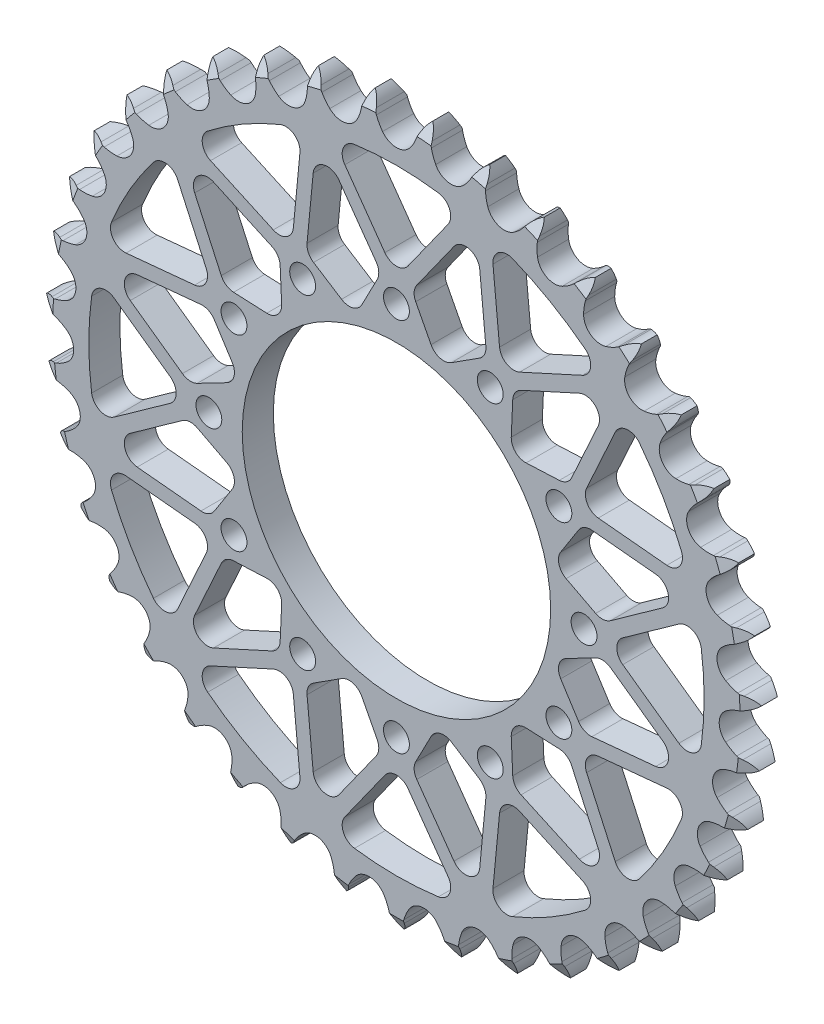
from build123d import *

# Parameters (mm, degrees)
EXTRUSION_DEPTH          = 7.2136
CUT_EXTRUDE_DEPTH        = 118.514389318
CUT_EXTRUDE_DEPTH_BACK   = 118.514389318
SKETCH1_R                = 35.764294032
F_6_0MM_DOWEL_HOLE1_D    = 6
CIRPATTERN1_COUNT        = 12
CUT_EXTRUDE2_DEPTH       = 118.514389318
FILLET2_R                = 3.302
CIRPATTERN3_COUNT        = 12
FILLET2_OF_CIRPATTERN3_R = 3.302


with BuildPart() as part:
    # Teeth Sketch → Extrusion (new body)
    with BuildSketch(Plane.XY):
        with BuildLine():
            ThreePointArc((6.676484762, 82.703103732), (5.710873677, 81.555589606), (5.037571935, 80.215493266))
            Line((5.037571935, 80.215493266), (4.65053543, 79.150636707))
            ThreePointArc((4.65053543, 79.150636707), (4.030589042, 77.787636082), (3.22092759, 76.5280518))
            ThreePointArc((3.22092759, 76.5280518), (0, 74.905926143), (-3.22092759, 76.5280518))
            ThreePointArc((-3.22092759, 76.5280518), (-4.030589042, 77.787636082), (-4.65053543, 79.150636707))
            Line((-4.65053543, 79.150636707), (-5.037571935, 80.215493266))
            ThreePointArc((-5.037571935, 80.215493266), (-5.710873677, 81.555589606), (-6.676484762, 82.703103732))
            ThreePointArc((-6.676484762, 82.703103732), (-7.445517227, 81.415554702), (-7.895133318, 79.984807062))
            Line((-7.895133318, 79.984807062), (-8.106342797, 78.871655094))
            ThreePointArc((-8.106342797, 78.871655094), (-8.499620367, 77.426858575), (-9.096745387, 76.053706749))
            ThreePointArc((-9.096745387, 76.053706749), (-12.015755556, 73.935914073), (-15.455180235, 75.020360508))
            ThreePointArc((-15.455180235, 75.020360508), (-16.456408311, 76.133754674), (-17.286967233, 77.379658404))
            Line((-17.286967233, 77.379658404), (-17.83980672, 78.368640329))
            ThreePointArc((-17.83980672, 78.368640329), (-18.719355953, 79.583377579), (-19.856536839, 80.561136787))
            ThreePointArc((-19.856536839, 80.561136787), (-20.409073146, 79.166899696), (-20.623358765, 77.682556369))
            Line((-20.623358765, 77.682556369), (-20.653271004, 76.549939044))
            ThreePointArc((-20.653271004, 76.549939044), (-20.809694072, 75.060766102), (-21.178817437, 73.609610642))
            ThreePointArc((-21.178817437, 73.609610642), (-23.720309356, 71.051000665), (-27.289151829, 71.569681286))
            ThreePointArc((-27.289151829, 71.569681286), (-28.456015249, 72.508049011), (-29.475675664, 73.604587595))
            Line((-29.475675664, 73.604587595), (-30.179999883, 74.492080773))
            ThreePointArc((-30.179999883, 74.492080773), (-31.243016742, 75.549997876), (-32.522315041, 76.332678717))
            ThreePointArc((-32.522315041, 76.332678717), (-32.844044791, 74.867863573), (-32.817450053, 73.368368272))
            Line((-32.817450053, 73.368368272), (-32.66529034, 72.245619783))
            ThreePointArc((-32.66529034, 72.245619783), (-32.580807632, 70.750639215), (-32.71236924, 69.259064285))
            ThreePointArc((-32.71236924, 69.259064285), (-34.810519602, 66.325903661), (-38.416348726, 66.265384911))
            ThreePointArc((-38.416348726, 66.265384911), (-39.71862634, 67.004422965), (-40.900979579, 67.923196629))
            Line((-40.900979579, 67.923196629), (-41.738546902, 68.686215454))
            ThreePointArc((-41.738546902, 68.686215454), (-42.957499809, 69.559912912), (-44.345782367, 70.127244363))
            ThreePointArc((-44.345782367, 70.127244363), (-44.428372928, 68.629789109), (-44.161586623, 67.153977974))
            Line((-44.161586623, 67.153977974), (-43.831295815, 66.070176918))
            ThreePointArc((-43.831295815, 66.070176918), (-43.508095388, 64.608107935), (-43.398687863, 63.114744543))
            ThreePointArc((-43.398687863, 63.114744543), (-44.999155676, 59.883000591), (-48.54858237, 59.244849876))
            ThreePointArc((-48.54858237, 59.244849876), (-49.952545871, 59.765417561), (-51.266969607, 60.48263055))
            Line((-51.266969607, 60.48263055), (-52.21608748, 61.101413234))
            ThreePointArc((-52.21608748, 61.101413234), (-53.559406195, 61.768262742), (-55.020717224, 62.105551216))
            ThreePointArc((-55.020717224, 62.105551216), (-54.862029543, 60.614239157), (-54.361961296, 59.200334922))
            Line((-54.361961296, 59.200334922), (-53.862093752, 58.183551176))
            ThreePointArc((-53.862093752, 58.183551176), (-53.308546327, 56.792260597), (-52.961003266, 55.335786069))
            ThreePointArc((-52.961003266, 55.335786069), (-54.022337255, 51.889159262), (-57.423433231, 50.689904348))
            ThreePointArc((-57.423433231, 50.689904348), (-58.892720703, 50.978519235), (-60.305172051, 51.475596109))
            Line((-60.305172051, 51.475596109), (-61.34125882, 51.934116506))
            ThreePointArc((-61.34125882, 51.934116506), (-62.774152094, 52.376847013), (-64.270644405, 52.475356916))
            ThreePointArc((-64.270644405, 52.475356916), (-63.87478841, 51.02881225), (-63.154389727, 49.713434291))
            Line((-63.154389727, 49.713434291), (-62.497891753, 48.790002021))
            ThreePointArc((-62.497891753, 48.790002021), (-61.728333918, 47.505523541), (-61.151656504, 46.123659804))
            ThreePointArc((-61.151656504, 46.123659804), (-61.646368676, 42.551415963), (-64.811047336, 40.822116924))
            ThreePointArc((-64.811047336, 40.822116924), (-66.307605004, 40.871304038), (-67.781502216, 41.135370767))
            Line((-67.781502216, 41.135370767), (-68.877723777, 41.42175344))
            ThreePointArc((-68.877723777, 41.42175344), (-70.363080428, 41.628898458), (-71.855995657, 41.486078435))
            ThreePointArc((-71.855995657, 41.486078435), (-71.23322381, 40.12176591), (-70.311152637, 38.938981826))
            Line((-70.311152637, 38.938981826), (-69.515027187, 38.132817442))
            ThreePointArc((-69.515027187, 38.132817442), (-68.549390085, 36.988418379), (-67.75851396, 35.716954977))
            ThreePointArc((-67.75851396, 35.716954977), (-67.673791529, 32.111613343), (-70.520089358, 29.897058114))
            ThreePointArc((-70.520089358, 29.897058114), (-72.005157166, 29.705543536), (-73.502327078, 29.729760931))
            Line((-73.502327078, 29.729760931), (-74.630291869, 29.836588719))
            ThreePointArc((-74.630291869, 29.836588719), (-76.129641939, 29.8027833), (-77.580314364, 29.422332315))
            ThreePointArc((-77.580314364, 29.422332315), (-76.74675613, 28.175586908), (-75.646893627, 27.156030185))
            Line((-75.646893627, 27.156030185), (-74.731759931, 26.488012922))
            ThreePointArc((-74.731759931, 26.488012922), (-73.595053056, 25.51333261), (-72.610461496, 24.385199777))
            ThreePointArc((-72.610461496, 24.385199777), (-71.948498729, 20.840136804), (-74.402698108, 18.197681204))
            ThreePointArc((-74.402698108, 18.197681204), (-75.837813579, 17.77042506), (-77.319480277, 17.554165902))
            Line((-77.319480277, 17.554165902), (-78.449974603, 17.478672021))
            ThreePointArc((-78.449974603, 17.478672021), (-79.924485713, 17.204791709), (-81.295343681, 16.596563242))
            ThreePointArc((-81.295343681, 16.596563242), (-80.27258778, 15.499675005), (-79.023419807, 14.669751627))
            Line((-79.023419807, 14.669751627), (-78.012979347, 14.15718278))
            ThreePointArc((-78.012979347, 14.15718278), (-76.734642811, 13.377464928), (-75.58183622, 12.421880712))
            ThreePointArc((-75.58183622, 12.421880712), (-74.359777605, 9.028911669), (-76.358316059, 6.026993909))
            ThreePointArc((-76.358316059, 6.026993909), (-77.706310456, 5.375061909), (-79.134099551, 4.923927198))
            Line((-79.134099551, 4.923927198), (-80.237844202, 4.6680669))
            ThreePointArc((-80.237844202, 4.6680669), (-81.649327289, 4.161205049), (-82.904866299, 3.340951899))
            ThreePointArc((-82.904866299, 3.340951899), (-81.719401571, 2.422329661), (-80.353280924, 1.803534207))
            Line((-80.353280924, 1.803534207), (-79.273703577, 1.45968904))
            ThreePointArc((-79.273703577, 1.45968904), (-77.886845624, 0.895127931), (-76.595681088, 0.136841462))
            ThreePointArc((-76.595681088, 0.136841462), (-74.8451773, -3.016157536), (-76.336293733, -6.299789363))
            ThreePointArc((-76.336293733, -6.299789363), (-77.56225471, -7.159512522), (-78.899187214, -7.833838635))
            Line((-78.899187214, -7.833838635), (-79.947595784, -8.263438702))
            ThreePointArc((-79.947595784, -8.263438702), (-81.259494176, -8.990154635), (-82.367196428, -10.001188343))
            ThreePointArc((-82.367196428, -10.001188343), (-81.049725787, -10.717752749), (-79.602034272, -11.109393802))
            Line((-79.602034272, -11.109393802), (-78.481280524, -11.275609878))
            ThreePointArc((-78.481280524, -11.275609878), (-77.021820047, -11.610392409), (-75.625738049, -12.151741911))
            ThreePointArc((-75.625738049, -12.151741911), (-73.392126218, -14.983109845), (-74.337201497, -18.463411399))
            ThreePointArc((-74.337201497, -18.463411399), (-75.409377308, -19.50865934), (-76.620827372, -20.388712162))
            Line((-76.620827372, -20.388712162), (-77.586746629, -20.980925582))
            ThreePointArc((-77.586746629, -20.980925582), (-78.765082849, -21.908674036), (-79.696259435, -23.08430306))
            ThreePointArc((-79.696259435, -23.08430306), (-78.280904679, -23.580250992), (-76.789136745, -23.734594346))
            Line((-76.789136745, -23.734594346), (-75.656233531, -23.718876424))
            ThreePointArc((-75.656233531, -23.718876424), (-74.161969788, -23.815209685), (-72.697128119, -24.125601551))
            ThreePointArc((-72.697128119, -24.125601551), (-70.038257617, -26.562007479), (-70.41281479, -30.148840778))
            ThreePointArc((-70.41281479, -30.148840778), (-71.303436645, -31.352542128), (-72.358028349, -32.415528753))
            Line((-72.358028349, -32.415528753), (-73.216441492, -33.155017511))
            ThreePointArc((-73.216441492, -33.155017511), (-74.230697248, -34.259770288), (-74.961231185, -35.569546454))
            ThreePointArc((-74.961231185, -35.569546454), (-73.484649258, -35.832033121), (-71.987440912, -35.745081364))
            Line((-71.987440912, -35.745081364), (-70.871729829, -35.547836529))
            ThreePointArc((-70.871729829, -35.547836529), (-69.381363468, -35.403225539), (-67.885700756, -35.474620783))
            ThreePointArc((-67.885700756, -35.474620783), (-64.870434934, -37.452963072), (-64.664773166, -41.053431017))
            ThreePointArc((-64.664773166, -41.053431017), (-65.350774426, -42.384410543), (-66.221194398, -43.602800177))
            Line((-66.221194398, -43.602800177), (-66.949868978, -44.470411902))
            ThreePointArc((-66.949868978, -44.470411902), (-67.773775581, -45.723556485), (-68.284746423, -47.133557278))
            ThreePointArc((-68.284746423, -47.133557278), (-66.785180021, -47.155784414), (-65.321308173, -46.829789551))
            Line((-65.321308173, -46.829789551), (-64.251685552, -46.456126341))
            ThreePointArc((-64.251685552, -46.456126341), (-62.803816278, -46.074316448), (-61.316069403, -45.904865971))
            ThreePointArc((-61.316069403, -45.904865971), (-58.022502061, -47.373906594), (-57.241947884, -50.894758957))
            ThreePointArc((-57.241947884, -50.894758957), (-57.705561477, -52.318544989), (-58.369266298, -53.66078198))
            Line((-58.369266298, -53.66078198), (-58.949330025, -54.634045983))
            ThreePointArc((-58.949330025, -54.634045983), (-59.561548726, -56.003126587), (-59.839722596, -57.476833727))
            ThreePointArc((-59.839722596, -57.476833727), (-58.356009703, -57.25822566), (-56.963387864, -56.701630787))
            Line((-56.963387864, -56.701630787), (-55.967556369, -56.161226883))
            ThreePointArc((-55.967556369, -56.161226883), (-54.599683236, -55.552106762), (-53.15838406, -55.146199243))
            ThreePointArc((-53.15838406, -55.146199243), (-49.671816862, -56.06789082), (-48.336586219, -59.417939375))
            ThreePointArc((-48.336586219, -59.417939375), (-48.565804798, -60.897656602), (-49.00560486, -62.328977716))
            Line((-49.00560486, -62.328977716), (-49.422034389, -63.382686971))
            ThreePointArc((-49.422034389, -63.382686971), (-49.806709045, -64.832245127), (-49.844881387, -66.331490374))
            ThreePointArc((-49.844881387, -66.331490374), (-48.415449386, -65.877708938), (-47.130145731, -65.104929569))
            Line((-47.130145731, -65.104929569), (-46.233896874, -64.411781148))
            ThreePointArc((-46.233896874, -64.411781148), (-44.981447078, -63.591126692), (-43.623924493, -62.959274922))
            ThreePointArc((-43.623924493, -62.959274922), (-40.034657698, -63.309746125), (-38.179332362, -66.402226373))
            ThreePointArc((-38.179332362, -66.402226373), (-38.168219284, -67.899550896), (-38.372723998, -69.38288567))
            Line((-38.372723998, -69.38288567), (-38.614734022, -70.489749661))
            ThreePointArc((-38.614734022, -70.489749661), (-38.761901763, -71.982242573), (-38.559083932, -73.468196262))
            ThreePointArc((-38.559083932, -73.468196262), (-37.220954361, -72.790994159), (-36.076257579, -71.822044874))
            Line((-36.076257579, -71.822044874), (-35.302803736, -70.994104116))
            ThreePointArc((-35.302803736, -70.994104116), (-34.198215068, -69.983169844), (-32.959628196, -69.141738451))
            ThreePointArc((-32.959628196, -69.141738451), (-29.360621929, -68.91191226), (-27.033253851, -71.666730588))
            ThreePointArc((-27.033253851, -71.666730588), (-26.78209694, -73.142882488), (-26.74600974, -74.639813329))
            Line((-26.74600974, -74.639813329), (-26.807332328, -75.77116486))
            ThreePointArc((-26.807332328, -75.77116486), (-26.713181585, -77.267937748), (-26.274626458, -78.702114459))
            ThreePointArc((-26.274626458, -78.702114459), (-25.06245617, -77.819030866), (-24.088013307, -76.679006943))
            Line((-24.088013307, -76.679006943), (-23.457386525, -75.737717079))
            ThreePointArc((-23.457386525, -75.737717079), (-22.529267252, -74.562685657), (-21.441694841, -73.533467273))
            ThreePointArc((-21.441694841, -73.533467273), (-17.926161474, -72.729296065), (-15.187028265, -75.075104125))
            ThreePointArc((-15.187028265, -75.075104125), (-14.702332353, -76.491851845), (-14.426587879, -77.96360903))
            Line((-14.426587879, -77.96360903), (-14.305634807, -79.090146691))
            ThreePointArc((-14.305634807, -79.090146691), (-13.972604036, -80.552433921), (-13.309669959, -81.897689231))
            ThreePointArc((-13.309669959, -81.897689231), (-12.254853529, -80.83159555), (-11.475902142, -79.55002301))
            Line((-11.475902142, -79.55002301), (-11.004435324, -78.519762952))
            ThreePointArc((-11.004435324, -78.519762952), (-10.276823247, -77.211067077), (-9.368432854, -76.020717918))
            ThreePointArc((-9.368432854, -76.020717918), (-6.027422853, -74.663029306), (-2.947466624, -76.5390719))
            ThreePointArc((-2.947466624, -76.5390719), (-2.241785081, -77.859722417), (-1.733524971, -79.26818821))
            Line((-1.733524971, -79.26818821), (-1.43342886, -80.360735266))
            ThreePointArc((-1.43342886, -80.360735266), (-0.870143382, -81.750664368), (0, -82.97215687))
            ThreePointArc((0, -82.97215687), (0.870143382, -81.750664368), (1.43342886, -80.360735266))
            Line((1.43342886, -80.360735266), (1.733524971, -79.26818821))
            ThreePointArc((1.733524971, -79.26818821), (2.241785081, -77.859722417), (2.947466624, -76.5390719))
            ThreePointArc((2.947466624, -76.5390719), (6.027422853, -74.663029306), (9.368432854, -76.020717918))
            ThreePointArc((9.368432854, -76.020717918), (10.276823247, -77.211067077), (11.004435324, -78.519762952))
            Line((11.004435324, -78.519762952), (11.475902142, -79.55002301))
            ThreePointArc((11.475902142, -79.55002301), (12.254853529, -80.83159555), (13.309669959, -81.897689231))
            ThreePointArc((13.309669959, -81.897689231), (13.972604036, -80.552433921), (14.305634807, -79.090146691))
            Line((14.305634807, -79.090146691), (14.426587879, -77.96360903))
            ThreePointArc((14.426587879, -77.96360903), (14.702332353, -76.491851845), (15.187028265, -75.075104125))
            ThreePointArc((15.187028265, -75.075104125), (17.926161474, -72.729296065), (21.441694841, -73.533467273))
            ThreePointArc((21.441694841, -73.533467273), (22.529267252, -74.562685657), (23.457386525, -75.737717079))
            Line((23.457386525, -75.737717079), (24.088013307, -76.679006943))
            ThreePointArc((24.088013307, -76.679006943), (25.06245617, -77.819030866), (26.274626458, -78.702114459))
            ThreePointArc((26.274626458, -78.702114459), (26.713181585, -77.267937748), (26.807332328, -75.77116486))
            Line((26.807332328, -75.77116486), (26.74600974, -74.639813329))
            ThreePointArc((26.74600974, -74.639813329), (26.78209694, -73.142882488), (27.033253851, -71.666730588))
            ThreePointArc((27.033253851, -71.666730588), (29.360621929, -68.91191226), (32.959628196, -69.141738451))
            ThreePointArc((32.959628196, -69.141738451), (34.198215068, -69.983169844), (35.302803736, -70.994104116))
            Line((35.302803736, -70.994104116), (36.076257579, -71.822044874))
            ThreePointArc((36.076257579, -71.822044874), (37.220954361, -72.790994159), (38.559083932, -73.468196262))
            ThreePointArc((38.559083932, -73.468196262), (38.761901763, -71.982242573), (38.614734022, -70.489749661))
            Line((38.614734022, -70.489749661), (38.372723998, -69.38288567))
            ThreePointArc((38.372723998, -69.38288567), (38.168219284, -67.899550896), (38.179332362, -66.402226373))
            ThreePointArc((38.179332362, -66.402226373), (40.034657698, -63.309746125), (43.623924493, -62.959274922))
            ThreePointArc((43.623924493, -62.959274922), (44.981447078, -63.591126692), (46.233896874, -64.411781148))
            Line((46.233896874, -64.411781148), (47.130145731, -65.104929569))
            ThreePointArc((47.130145731, -65.104929569), (48.415449386, -65.877708938), (49.844881387, -66.331490374))
            ThreePointArc((49.844881387, -66.331490374), (49.806709045, -64.832245127), (49.422034389, -63.382686971))
            Line((49.422034389, -63.382686971), (49.00560486, -62.328977716))
            ThreePointArc((49.00560486, -62.328977716), (48.565804798, -60.897656602), (48.336586219, -59.417939375))
            ThreePointArc((48.336586219, -59.417939375), (49.671816862, -56.06789082), (53.15838406, -55.146199243))
            ThreePointArc((53.15838406, -55.146199243), (54.599683236, -55.552106762), (55.967556369, -56.161226883))
            Line((55.967556369, -56.161226883), (56.963387864, -56.701630787))
            ThreePointArc((56.963387864, -56.701630787), (58.356009703, -57.25822566), (59.839722596, -57.476833727))
            ThreePointArc((59.839722596, -57.476833727), (59.561548726, -56.003126587), (58.949330025, -54.634045983))
            Line((58.949330025, -54.634045983), (58.369266298, -53.66078198))
            ThreePointArc((58.369266298, -53.66078198), (57.705561477, -52.318544989), (57.241947884, -50.894758957))
            ThreePointArc((57.241947884, -50.894758957), (58.022502061, -47.373906594), (61.316069403, -45.904865971))
            ThreePointArc((61.316069403, -45.904865971), (62.803816278, -46.074316448), (64.251685552, -46.456126341))
            Line((64.251685552, -46.456126341), (65.321308173, -46.829789551))
            ThreePointArc((65.321308173, -46.829789551), (66.785180021, -47.155784414), (68.284746423, -47.133557278))
            ThreePointArc((68.284746423, -47.133557278), (67.773775581, -45.723556485), (66.949868978, -44.470411902))
            Line((66.949868978, -44.470411902), (66.221194398, -43.602800177))
            ThreePointArc((66.221194398, -43.602800177), (65.350774426, -42.384410543), (64.664773166, -41.053431017))
            ThreePointArc((64.664773166, -41.053431017), (64.870434934, -37.452963072), (67.885700756, -35.474620783))
            ThreePointArc((67.885700756, -35.474620783), (69.381363468, -35.403225539), (70.871729829, -35.547836529))
            Line((70.871729829, -35.547836529), (71.987440912, -35.745081364))
            ThreePointArc((71.987440912, -35.745081364), (73.484649258, -35.832033121), (74.961231185, -35.569546454))
            ThreePointArc((74.961231185, -35.569546454), (74.230697248, -34.259770288), (73.216441492, -33.155017511))
            Line((73.216441492, -33.155017511), (72.358028349, -32.415528753))
            ThreePointArc((72.358028349, -32.415528753), (71.303436645, -31.352542128), (70.41281479, -30.148840778))
            ThreePointArc((70.41281479, -30.148840778), (70.038257617, -26.562007479), (72.697128119, -24.125601551))
            ThreePointArc((72.697128119, -24.125601551), (74.161969788, -23.815209685), (75.656233531, -23.718876424))
            Line((75.656233531, -23.718876424), (76.789136745, -23.734594346))
            ThreePointArc((76.789136745, -23.734594346), (78.280904679, -23.580250992), (79.696259435, -23.08430306))
            ThreePointArc((79.696259435, -23.08430306), (78.765082849, -21.908674036), (77.586746629, -20.980925582))
            Line((77.586746629, -20.980925582), (76.620827372, -20.388712162))
            ThreePointArc((76.620827372, -20.388712162), (75.409377308, -19.50865934), (74.337201497, -18.463411399))
            ThreePointArc((74.337201497, -18.463411399), (73.392126218, -14.983109845), (75.625738049, -12.151741911))
            ThreePointArc((75.625738049, -12.151741911), (77.021820047, -11.610392409), (78.481280524, -11.275609878))
            Line((78.481280524, -11.275609878), (79.602034272, -11.109393802))
            ThreePointArc((79.602034272, -11.109393802), (81.049725787, -10.717752749), (82.367196428, -10.001188343))
            ThreePointArc((82.367196428, -10.001188343), (81.259494176, -8.990154635), (79.947595784, -8.263438702))
            Line((79.947595784, -8.263438702), (78.899187214, -7.833838635))
            ThreePointArc((78.899187214, -7.833838635), (77.56225471, -7.159512522), (76.336293733, -6.299789363))
            ThreePointArc((76.336293733, -6.299789363), (74.8451773, -3.016157536), (76.595681088, 0.136841462))
            ThreePointArc((76.595681088, 0.136841462), (77.886845624, 0.895127931), (79.273703577, 1.45968904))
            Line((79.273703577, 1.45968904), (80.353280924, 1.803534207))
            ThreePointArc((80.353280924, 1.803534207), (81.719401571, 2.422329661), (82.904866299, 3.340951899))
            ThreePointArc((82.904866299, 3.340951899), (81.649327289, 4.161205049), (80.237844202, 4.6680669))
            Line((80.237844202, 4.6680669), (79.134099551, 4.923927198))
            ThreePointArc((79.134099551, 4.923927198), (77.706310456, 5.375061909), (76.358316059, 6.026993909))
            ThreePointArc((76.358316059, 6.026993909), (74.359777605, 9.028911669), (75.58183622, 12.421880712))
            ThreePointArc((75.58183622, 12.421880712), (76.734642811, 13.377464928), (78.012979347, 14.15718278))
            Line((78.012979347, 14.15718278), (79.023419807, 14.669751627))
            ThreePointArc((79.023419807, 14.669751627), (80.27258778, 15.499675005), (81.295343681, 16.596563242))
            ThreePointArc((81.295343681, 16.596563242), (79.924485713, 17.204791709), (78.449974603, 17.478672021))
            Line((78.449974603, 17.478672021), (77.319480277, 17.554165902))
            ThreePointArc((77.319480277, 17.554165902), (75.837813579, 17.77042506), (74.402698108, 18.197681204))
            ThreePointArc((74.402698108, 18.197681204), (71.948498729, 20.840136804), (72.610461496, 24.385199777))
            ThreePointArc((72.610461496, 24.385199777), (73.595053056, 25.51333261), (74.731759931, 26.488012922))
            Line((74.731759931, 26.488012922), (75.646893627, 27.156030185))
            ThreePointArc((75.646893627, 27.156030185), (76.74675613, 28.175586908), (77.580314364, 29.422332315))
            ThreePointArc((77.580314364, 29.422332315), (76.129641939, 29.8027833), (74.630291869, 29.836588719))
            Line((74.630291869, 29.836588719), (73.502327078, 29.729760931))
            ThreePointArc((73.502327078, 29.729760931), (72.005157166, 29.705543536), (70.520089358, 29.897058114))
            ThreePointArc((70.520089358, 29.897058114), (67.673791529, 32.111613343), (67.75851396, 35.716954977))
            ThreePointArc((67.75851396, 35.716954977), (68.549390085, 36.988418379), (69.515027187, 38.132817442))
            Line((69.515027187, 38.132817442), (70.311152637, 38.938981826))
            ThreePointArc((70.311152637, 38.938981826), (71.23322381, 40.12176591), (71.855995657, 41.486078435))
            ThreePointArc((71.855995657, 41.486078435), (70.363080428, 41.628898458), (68.877723777, 41.42175344))
            Line((68.877723777, 41.42175344), (67.781502216, 41.135370767))
            ThreePointArc((67.781502216, 41.135370767), (66.307605004, 40.871304038), (64.811047336, 40.822116924))
            ThreePointArc((64.811047336, 40.822116924), (61.646368676, 42.551415963), (61.151656504, 46.123659804))
            ThreePointArc((61.151656504, 46.123659804), (61.728333918, 47.505523541), (62.497891753, 48.790002021))
            Line((62.497891753, 48.790002021), (63.154389727, 49.713434291))
            ThreePointArc((63.154389727, 49.713434291), (63.87478841, 51.02881225), (64.270644405, 52.475356916))
            ThreePointArc((64.270644405, 52.475356916), (62.774152094, 52.376847013), (61.34125882, 51.934116506))
            Line((61.34125882, 51.934116506), (60.305172051, 51.475596109))
            ThreePointArc((60.305172051, 51.475596109), (58.892720703, 50.978519235), (57.423433231, 50.689904348))
            ThreePointArc((57.423433231, 50.689904348), (54.022337255, 51.889159262), (52.961003266, 55.335786069))
            ThreePointArc((52.961003266, 55.335786069), (53.308546327, 56.792260597), (53.862093752, 58.183551176))
            Line((53.862093752, 58.183551176), (54.361961296, 59.200334922))
            ThreePointArc((54.361961296, 59.200334922), (54.862029543, 60.614239157), (55.020717224, 62.105551216))
            ThreePointArc((55.020717224, 62.105551216), (53.559406195, 61.768262742), (52.21608748, 61.101413234))
            Line((52.21608748, 61.101413234), (51.266969607, 60.48263055))
            ThreePointArc((51.266969607, 60.48263055), (49.952545871, 59.765417561), (48.54858237, 59.244849876))
            ThreePointArc((48.54858237, 59.244849876), (44.999155676, 59.883000591), (43.398687863, 63.114744543))
            ThreePointArc((43.398687863, 63.114744543), (43.508095388, 64.608107935), (43.831295815, 66.070176918))
            Line((43.831295815, 66.070176918), (44.161586623, 67.153977974))
            ThreePointArc((44.161586623, 67.153977974), (44.428372928, 68.629789109), (44.345782367, 70.127244363))
            ThreePointArc((44.345782367, 70.127244363), (42.957499809, 69.559912912), (41.738546902, 68.686215454))
            Line((41.738546902, 68.686215454), (40.900979579, 67.923196629))
            ThreePointArc((40.900979579, 67.923196629), (39.71862634, 67.004422965), (38.416348726, 66.265384911))
            ThreePointArc((38.416348726, 66.265384911), (34.810519602, 66.325903661), (32.71236924, 69.259064285))
            ThreePointArc((32.71236924, 69.259064285), (32.580807632, 70.750639215), (32.66529034, 72.245619783))
            Line((32.66529034, 72.245619783), (32.817450053, 73.368368272))
            ThreePointArc((32.817450053, 73.368368272), (32.844044791, 74.867863573), (32.522315041, 76.332678717))
            ThreePointArc((32.522315041, 76.332678717), (31.243016742, 75.549997876), (30.179999883, 74.492080773))
            Line((30.179999883, 74.492080773), (29.475675664, 73.604587595))
            ThreePointArc((29.475675664, 73.604587595), (28.456015249, 72.508049011), (27.289151829, 71.569681286))
            ThreePointArc((27.289151829, 71.569681286), (23.720309356, 71.051000665), (21.178817437, 73.609610642))
            ThreePointArc((21.178817437, 73.609610642), (20.809694072, 75.060766102), (20.653271004, 76.549939044))
            Line((20.653271004, 76.549939044), (20.623358765, 77.682556369))
            ThreePointArc((20.623358765, 77.682556369), (20.409073146, 79.166899696), (19.856536839, 80.561136787))
            ThreePointArc((19.856536839, 80.561136787), (18.719355953, 79.583377579), (17.83980672, 78.368640329))
            Line((17.83980672, 78.368640329), (17.286967233, 77.379658404))
            ThreePointArc((17.286967233, 77.379658404), (16.456408311, 76.133754674), (15.455180235, 75.020360508))
            ThreePointArc((15.455180235, 75.020360508), (12.015755556, 73.935914073), (9.096745387, 76.053706749))
            ThreePointArc((9.096745387, 76.053706749), (8.499620367, 77.426858575), (8.106342797, 78.871655094))
            Line((8.106342797, 78.871655094), (7.895133318, 79.984807062))
            ThreePointArc((7.895133318, 79.984807062), (7.445517227, 81.415554702), (6.676484762, 82.703103732))
        make_face()
    extrude(amount=EXTRUSION_DEPTH)

    # Sketch1 → Cut-Extrude (cut, two sides: drawn at the far end of the back side and taken through both)
    with BuildSketch(Plane(origin=(0, 0, 0), x_dir=(-1, 0, 0), z_dir=(0, 0, -1)).offset(-CUT_EXTRUDE_DEPTH_BACK)):
        Circle(SKETCH1_R)
    extrude(amount=CUT_EXTRUDE_DEPTH + CUT_EXTRUDE_DEPTH_BACK, mode=Mode.SUBTRACT)

    # Ø6.0mm Dowel Hole1 (through all)
    with Locations(Plane.XY.offset(7.2136)):
        with Locations((-43.500000122, 0)):
            f_6_0mm_dowel_hole1 = Hole(F_6_0MM_DOWEL_HOLE1_D / 2)

    # CirPattern1: Ø6.0mm Dowel Hole1 ×12 about axis
    cirpattern1_axis = Axis((0, 0, 0), (0, 0, 1))
    for i in range(1, CIRPATTERN1_COUNT):
        add(f_6_0mm_dowel_hole1.rotate(cirpattern1_axis, i * 360 / CIRPATTERN1_COUNT), mode=Mode.SUBTRACT)

    # Sketch9 → Cut-Extrude2 (cut, through all)
    with BuildSketch(Plane.XY):
        with BuildLine():
            Line((-48.707000122, 0), (-69.753908506, 15.006805414))
            ThreePointArc((-69.753908506, 15.006805414), (-71.349926143, 0), (-69.753908506, -15.006805414))
            Line((-69.753908506, -15.006805414), (-48.707000122, 0))
        make_face()
        Polygon((-47.983941179, 3.539852965), (-68.918736366, 18.466719753), (-43.325238517, 20.926367996), (-36.140398804, 9.683790674), align=None)
    cut_extrude2 = extrude(amount=CUT_EXTRUDE2_DEPTH, mode=Mode.SUBTRACT)

    # Fillet2
    fillet2_edges = [part.edges().sort_by_distance(p)[0] for p in [
        (-68.918736366, 18.466719753, 3.6068),
        (-47.983941179, 3.539852965, 3.6068),
        (-36.140398804, 9.683790674, 3.6068),
        (-43.325238517, 20.926367996, 3.6068),
        (-48.707000122, 0, 3.6068),
        (-69.753908506, 15.006805414, 3.6068),
        (-69.753908506, -15.006805414, 3.6068),
    ]]
    fillet(fillet2_edges, radius=FILLET2_R)

    # CirPattern3: Cut-Extrude2 ×12 about axis
    cirpattern3_axis = Axis((0, 0, 0), (0, 0, 1))
    for i in range(1, CIRPATTERN3_COUNT):
        add(cut_extrude2.rotate(cirpattern3_axis, i * 360 / CIRPATTERN3_COUNT), mode=Mode.SUBTRACT)

    # Fillet2 of CirPattern3
    fillet2_of_cirpattern3_edges = [part.edges().sort_by_distance(p)[0] for p in [
        (-68.918736366, -18.466719753, 3.6068),
        (-43.325238517, -20.926367996, 3.6068),
        (-36.140398804, -9.683790674, 3.6068),
        (-47.983941179, -3.539852965, 3.6068),
        (-42.181499448, -24.353500061, 3.6068),
        (-67.912059487, -21.880679535, 3.6068),
        (-52.905254073, -47.873228971, 3.6068),
        (-50.452016613, -50.452016613, 3.6068),
        (-27.057573183, -39.785385552, 3.6068),
        (-26.45660813, -26.45660813, 3.6068),
        (-39.785385552, -27.057573183, 3.6068),
        (-24.353500061, -42.181499448, 3.6068),
        (-47.873228971, -52.905254073, 3.6068),
        (-21.880679535, -67.912059487, 3.6068),
        (-18.466719753, -68.918736366, 3.6068),
        (-3.539852965, -47.983941179, 3.6068),
        (-9.683790674, -36.140398804, 3.6068),
        (-20.926367996, -43.325238517, 3.6068),
        (0, -48.707000122, 3.6068),
        (-15.006805414, -69.753908506, 3.6068),
        (15.006805414, -69.753908506, 3.6068),
        (18.466719753, -68.918736366, 3.6068),
        (20.926367996, -43.325238517, 3.6068),
        (9.683790674, -36.140398804, 3.6068),
        (3.539852965, -47.983941179, 3.6068),
        (24.353500061, -42.181499448, 3.6068),
        (21.880679535, -67.912059487, 3.6068),
        (47.873228971, -52.905254073, 3.6068),
        (50.452016613, -50.452016613, 3.6068),
        (39.785385552, -27.057573183, 3.6068),
        (26.45660813, -26.45660813, 3.6068),
        (27.057573183, -39.785385552, 3.6068),
        (42.181499448, -24.353500061, 3.6068),
        (52.905254073, -47.873228971, 3.6068),
        (67.912059487, -21.880679535, 3.6068),
        (68.918736366, -18.466719753, 3.6068),
        (47.983941179, -3.539852965, 3.6068),
        (36.140398804, -9.683790674, 3.6068),
        (43.325238517, -20.926367996, 3.6068),
        (48.707000122, 0, 3.6068),
        (69.753908506, -15.006805414, 3.6068),
        (69.753908506, 15.006805414, 3.6068),
        (68.918736366, 18.466719753, 3.6068),
        (43.325238517, 20.926367996, 3.6068),
        (36.140398804, 9.683790674, 3.6068),
        (47.983941179, 3.539852965, 3.6068),
        (42.181499448, 24.353500061, 3.6068),
        (67.912059487, 21.880679535, 3.6068),
        (52.905254073, 47.873228971, 3.6068),
        (50.452016613, 50.452016613, 3.6068),
        (27.057573183, 39.785385552, 3.6068),
        (26.45660813, 26.45660813, 3.6068),
        (39.785385552, 27.057573183, 3.6068),
        (24.353500061, 42.181499448, 3.6068),
        (47.873228971, 52.905254073, 3.6068),
        (21.880679535, 67.912059487, 3.6068),
        (18.466719753, 68.918736366, 3.6068),
        (3.539852965, 47.983941179, 3.6068),
        (9.683790674, 36.140398804, 3.6068),
        (20.926367996, 43.325238517, 3.6068),
        (0, 48.707000122, 3.6068),
        (15.006805414, 69.753908506, 3.6068),
        (-15.006805414, 69.753908506, 3.6068),
        (-18.466719753, 68.918736366, 3.6068),
        (-20.926367996, 43.325238517, 3.6068),
        (-9.683790674, 36.140398804, 3.6068),
        (-3.539852965, 47.983941179, 3.6068),
        (-24.353500061, 42.181499448, 3.6068),
        (-21.880679535, 67.912059487, 3.6068),
        (-47.873228971, 52.905254073, 3.6068),
        (-50.452016613, 50.452016613, 3.6068),
        (-39.785385552, 27.057573183, 3.6068),
        (-26.45660813, 26.45660813, 3.6068),
        (-27.057573183, 39.785385552, 3.6068),
        (-42.181499448, 24.353500061, 3.6068),
        (-52.905254073, 47.873228971, 3.6068),
        (-67.912059487, 21.880679535, 3.6068),
    ]]
    fillet(fillet2_of_cirpattern3_edges, radius=FILLET2_OF_CIRPATTERN3_R)

    # Sketch15 → Cut-Revolve1 (revolve, cut)
    with BuildSketch(Plane(origin=(0, 0, 0), x_dir=(0, 0, -1), z_dir=(1, 0, 0))):
        Polygon((-7.2136, -82.97215687), (-7.2136, -79.67015687), (-5.4356, -82.97215687), align=None)
    cut_revolve1 = revolve(axis=Axis((0, 0, 7.2136), (0, 0, -1)), mode=Mode.SUBTRACT)

    # Mirror1: Cut-Revolve1 across plane
    add(cut_revolve1.mirror(Plane(origin=(0, 0, 3.6068), x_dir=(1, 0, 0), z_dir=(0, 0, -1))), mode=Mode.SUBTRACT)


solid = part.part
